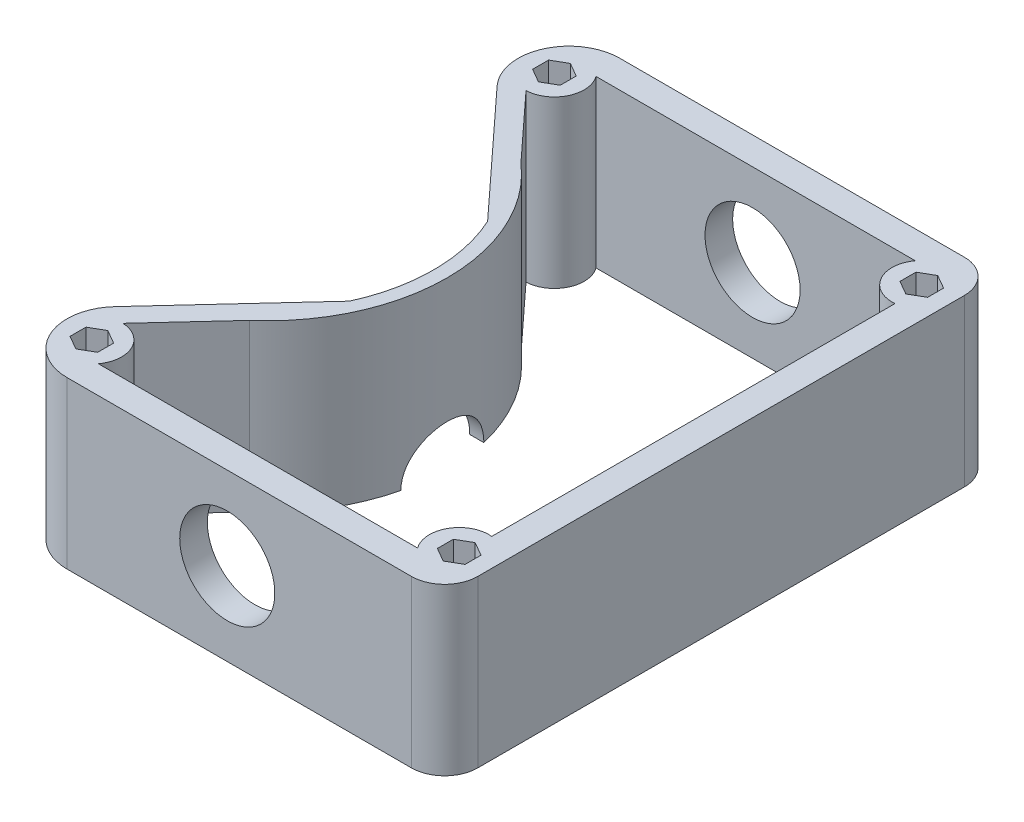
from build123d import *

# Parameters (mm, degrees)
SKETCH1_W               = 95.25
SKETCH1_H               = 6.35
BOSS_EXTRUDE1_DEPTH     = 38.1
SKETCH2_W               = 6.35
SKETCH2_H               = 127
BOSS_EXTRUDE2_DEPTH     = 38.1
SKETCH3_W               = 88.9
SKETCH3_H               = 6.35
BOSS_EXTRUDE3_DEPTH     = 38.1
FILLET1_R               = 7.62
BOSS_EXTRUDE4_DEPTH     = 38.1
CUT_EXTRUDE8_REACH      = 171.022
CUT_EXTRUDE8_END_RADIUS = 38.1
FILLET2_R               = 11.688947
FILLET3_R               = 11.688947
FILLET4_R               = 6.35
SKETCH15_R              = 6.841174209
BOSS_EXTRUDE7_DEPTH     = 38.1
CUT_EXTRUDE12_DEPTH     = 157.640484095
SKETCH4_R               = 10.922
CUT_EXTRUDE1_DEPTH      = 149.412147861


with BuildPart() as part:
    # Sketch1 → Boss-Extrude1 (new body)
    with BuildSketch(Plane(origin=(0, 0, 0), x_dir=(1, 0, 0), z_dir=(0, 1, 0))):
        with Locations((19.05, 12.7)):
            Rectangle(SKETCH1_W, SKETCH1_H)
    extrude(amount=BOSS_EXTRUDE1_DEPTH)

    # Sketch2 → Boss-Extrude2 (add)
    with BuildSketch(Plane(origin=(0, 38.1, 0), x_dir=(1, 0, 0), z_dir=(0, 1, 0))):
        with Locations((63.5, 73.025)):
            Rectangle(SKETCH2_W, SKETCH2_H)
    extrude(amount=-BOSS_EXTRUDE2_DEPTH)

    # Sketch3 → Boss-Extrude3 (add)
    with BuildSketch(Plane(origin=(0, 38.1, 0), x_dir=(1, 0, 0), z_dir=(0, 1, 0))):
        with Locations((15.875, 133.35)):
            Rectangle(SKETCH3_W, SKETCH3_H)
    extrude(amount=-BOSS_EXTRUDE3_DEPTH)

    # Fillet1
    fillet1_edges = [part.edges().sort_by_distance(p)[0] for p in [
        (66.675, 19.05, -136.525),
        (66.675, 19.05, -9.525),
    ]]
    fillet(fillet1_edges, radius=FILLET1_R)

    # Sketch10 → Boss-Extrude4 (add)
    with BuildSketch(Plane(origin=(0, 38.1, 0), x_dir=(1, 0, 0), z_dir=(0, 1, 0))):
        with BuildLine():
            Line((-28.575, 15.875), (-28.575, 9.525))
            Line((-28.575, 9.525), (-31.75, 9.525))
            Line((-31.75, 9.525), (-31.75, 25.781))
            Line((-31.75, 25.781), (-2.821027965, 57.15))
            ThreePointArc((-2.821027965, 57.15), (0.643811071, 73.025), (-2.821027965, 88.9))
            Line((-2.821027965, 88.9), (-31.75, 120.269))
            Line((-31.75, 120.269), (-31.75, 136.525))
            Line((-31.75, 136.525), (-28.575, 136.525))
            Line((-28.575, 136.525), (-28.575, 123.825))
            Line((-28.575, 123.825), (-10.494392478, 104.219375))
            ThreePointArc((-10.494392478, 104.219375), (3.775200806, 73.025), (-10.494392478, 41.830625))
            Line((-10.494392478, 41.830625), (-28.575, 22.225))
            Line((-28.575, 22.225), (-28.575, 15.875))
        make_face()
    extrude(amount=-BOSS_EXTRUDE4_DEPTH)

    # Cut-Extrude8: up to this cylinder (the profile starts outside it)
    cut_extrude8_end = Plane(origin=(-37.456188929, 4.042536, -73.025), z_dir=(0, 1, 0)) * Cylinder(CUT_EXTRUDE8_END_RADIUS, 419.244, mode=Mode.PRIVATE)
    # Sketch12 → Cut-Extrude8 (cut, up to the surface)
    with BuildSketch(Plane.ZY.offset(-60.325), mode=Mode.PRIVATE) as cut_extrude8_sk1:
        with BuildLine():
            Line((-82.55, 0), (-63.5, 0))
            ThreePointArc((-63.5, 0), (-73.025, 9.525), (-82.55, 0))
        make_face()
    cut_extrude8_tool1 = extrude(cut_extrude8_sk1.sketch, amount=CUT_EXTRUDE8_REACH, mode=Mode.PRIVATE) - cut_extrude8_end
    add(cut_extrude8_tool1.solids().sort_by_distance((60.325, 4.042536, -73.025))[0], mode=Mode.SUBTRACT)

    # Fillet2
    fillet2_edges = [part.edges().sort_by_distance(p)[0] for p in [
        (-31.75, 19.05, -136.525),
        (-31.75, 19.05, -120.269),
    ]]
    fillet(fillet2_edges, radius=FILLET2_R - 0.0001)  # a hair under: the kernel refuses the full size

    # Fillet3
    fillet3_edges = [part.edges().sort_by_distance(p)[0] for p in [
        (-31.75, 19.05, -25.781),
        (-31.75, 19.05, -9.525),
    ]]
    fillet(fillet3_edges, radius=FILLET3_R - 0.0001)  # a hair under: the kernel refuses the full size

    # Fillet4
    fillet4_edges = [part.edges().sort_by_distance(p)[0] for p in [
        (60.325, 19.05, -15.875),
        (60.325, 19.05, -130.175),
    ]]
    fillet(fillet4_edges, radius=FILLET4_R)

    # Sketch15 → Boss-Extrude7 (add)
    # profile 1 of 4: a face of its own
    with BuildSketch(Plane(origin=(0, 38.1, 0), x_dir=(1, 0, 0), z_dir=(0, 1, 0))):
        with Locations((59.652254611, 126.150383493)):
            Circle(SKETCH15_R)
        Polygon((59.652254611, 129.816557703), (56.477254611, 127.983470598), (56.477254611, 124.317296388), (59.652254611, 122.484209284), (62.827254611, 124.317296388), (62.827254611, 127.983470598), align=None, mode=Mode.SUBTRACT)
    # profile 2 of 4: a face of its own
    with BuildSketch(Plane(origin=(0, 38.1, 0), x_dir=(1, 0, 0), z_dir=(0, 1, 0))):
        with Locations((-24.727254611, 19.899616507)):
            Circle(SKETCH15_R)
        Polygon((-21.552254611, 21.732703612), (-24.727254611, 23.565790716), (-27.902254611, 21.732703612), (-27.902254611, 18.066529402), (-24.727254611, 16.233442297), (-21.552254611, 18.066529402), align=None, mode=Mode.SUBTRACT)
    # profile 3 of 4: a face of its own
    with BuildSketch(Plane(origin=(0, 38.1, 0), x_dir=(1, 0, 0), z_dir=(0, 1, 0))):
        with Locations((-24.727254611, 126.150383493)):
            Circle(SKETCH15_R)
        Polygon((-21.552254611, 127.983470598), (-21.552254611, 124.317296388), (-24.727254611, 122.484209284), (-27.902254611, 124.317296388), (-27.902254611, 127.983470598), (-24.727254611, 129.816557703), align=None, mode=Mode.SUBTRACT)
    # profile 4 of 4: a face of its own
    with BuildSketch(Plane(origin=(0, 38.1, 0), x_dir=(1, 0, 0), z_dir=(0, 1, 0))):
        with Locations((59.652254611, 19.899616507)):
            Circle(SKETCH15_R)
        Polygon((56.477254611, 18.066529402), (56.477254611, 21.732703612), (59.652254611, 23.565790716), (62.827254611, 21.732703612), (62.827254611, 18.066529402), (59.652254611, 16.233442297), align=None, mode=Mode.SUBTRACT)
    extrude(amount=-BOSS_EXTRUDE7_DEPTH)

    # Sketch21 → Cut-Extrude12 (cut, through all)
    with BuildSketch(Plane(origin=(0, 38.1, 0), x_dir=(1, 0, 0), z_dir=(0, 1, 0))):
        Polygon((-21.552254611, 21.732703612), (-24.727254611, 23.565790716), (-27.902254611, 21.732703612), (-27.902254611, 18.066529402), (-24.727254611, 16.233442297), (-21.552254611, 18.066529402), align=None)
        Polygon((56.477254611, 18.066529402), (56.477254611, 21.732703612), (59.652254611, 23.565790716), (62.827254611, 21.732703612), (62.827254611, 18.066529402), (59.652254611, 16.233442297), align=None)
        Polygon((59.652254611, 129.816557703), (56.477254611, 127.983470598), (56.477254611, 124.317296388), (59.652254611, 122.484209284), (62.827254611, 124.317296388), (62.827254611, 127.983470598), align=None)
        Polygon((-21.552254611, 127.983470598), (-21.552254611, 124.317296388), (-24.727254611, 122.484209284), (-27.902254611, 124.317296388), (-27.902254611, 127.983470598), (-24.727254611, 129.816557703), align=None)
    extrude(amount=-CUT_EXTRUDE12_DEPTH, mode=Mode.SUBTRACT)

    # Sketch4 → Cut-Extrude1 (cut, through all)
    with BuildSketch(Plane(origin=(0, 0, -136.525), x_dir=(-1, 0, 0), z_dir=(0, 0, -1))):
        with Locations((-16.756915998, 19.05)):
            Circle(SKETCH4_R)
    extrude(amount=-CUT_EXTRUDE1_DEPTH, mode=Mode.SUBTRACT)


solid = part.part
